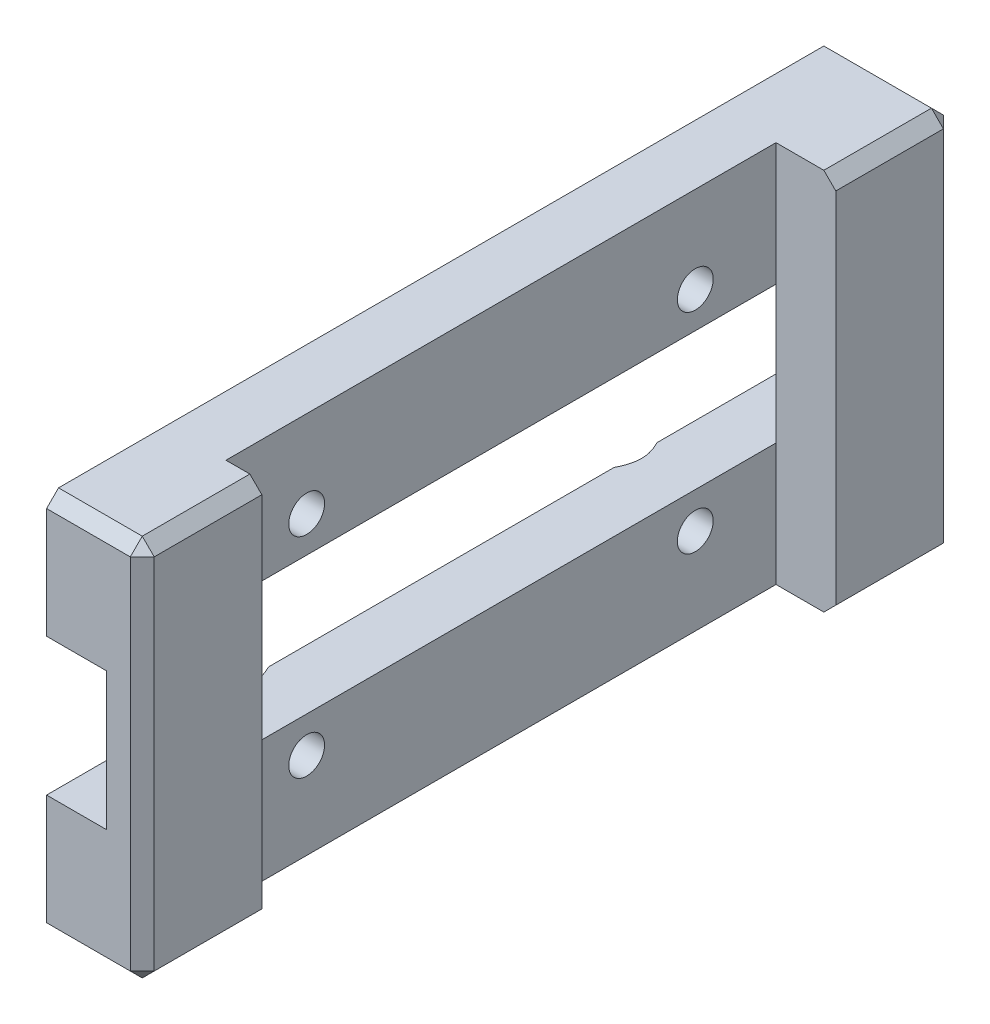
from build123d import *

# Parameters (mm, degrees)
SKETCH_2_W          = 66
SKETCH_2_H          = 32
EXTRUDE_1_DEPTH     = 5
SKETCH_3_W          = 46
SKETCH_3_H          = 11.5
CUT_EXTRUDE_2_DEPTH = 38.013511047
SKETCH_4_W          = 5
SKETCH_4_H          = 11.5
CUT_EXTRUDE_3_DEPTH = 69.095521145
SKETCH_5_W          = 10
SKETCH_5_H          = 32
EXTRUDE_2_DEPTH     = 5
SKETCH_6_W          = 10
SKETCH_6_H          = 32
EXTRUDE_3_DEPTH     = 3
SKETCH_7_R          = 1.5
CUT_EXTRUDE_4_DEPTH = 39.013155617
CHAMFER_1_SIZE      = 2
CHAMFER_2_SIZE      = 1


with BuildPart() as part:
    # 草图2 → 凸台-拉伸1 (new body)
    with BuildSketch(Plane(origin=(0, 0, 0), x_dir=(0, 0, -1), z_dir=(1, 0, 0))):
        Rectangle(SKETCH_2_W, SKETCH_2_H)
    extrude(amount=EXTRUDE_1_DEPTH)

    # 草图3 → 切除-拉伸2 (cut, through all)
    with BuildSketch(Plane.ZY):
        Rectangle(SKETCH_3_W, SKETCH_3_H)
    extrude(amount=-CUT_EXTRUDE_2_DEPTH, mode=Mode.SUBTRACT)

    # 草图4 → 切除-拉伸3 (cut, through all)
    with BuildSketch(Plane(origin=(0, 0, -33), x_dir=(-1, 0, 0), z_dir=(0, 0, -1))):
        with Locations((-2.5, 0)):
            Rectangle(SKETCH_4_W, SKETCH_4_H)
    extrude(amount=-CUT_EXTRUDE_3_DEPTH, mode=Mode.SUBTRACT)


with BuildPart() as cut_extrude_3_piece_1:
    # of the separate pieces the step leaves, piece 1, a body of its own (cut_extrude_3_pieces)
    add(part.part.solids().sort_by_distance((0, -16, -33))[0])



with BuildPart() as cut_extrude_3_piece_2:
    # of the separate pieces the step leaves, piece 2, a body of its own (cut_extrude_3_pieces)
    add(part.part.solids().sort_by_distance((0, 16, -33))[0])


with BuildPart() as cut_extrude_3_piece_1_1:
    add(cut_extrude_3_piece_1.part)

    add(cut_extrude_3_piece_2.part)  # 凸台-拉伸2 merges 切除-拉伸3 piece 2
    # 草图5 → 凸台-拉伸2 (add)
    with BuildSketch(Plane(origin=(5, 0, 0), x_dir=(0, 0, -1), z_dir=(1, 0, 0))):
        with Locations((28, 0)):
            Rectangle(SKETCH_5_W, SKETCH_5_H)
    extrude(amount=EXTRUDE_2_DEPTH)

    # 草图6 → 凸台-拉伸3 (add)
    with BuildSketch(Plane(origin=(5, 0, 0), x_dir=(0, 0, -1), z_dir=(1, 0, 0))):
        with Locations((-28, 0)):
            Rectangle(SKETCH_6_W, SKETCH_6_H)
    extrude(amount=EXTRUDE_3_DEPTH)

    # 草图7 → 切除-拉伸4 (cut, through all)
    with BuildSketch(Plane.ZY):
        with Locations((-16.25, 8.75)):
            Circle(SKETCH_7_R)
        with Locations((16.25, 8.75)):
            Circle(SKETCH_7_R)
        with Locations((16.25, -8.75)):
            Circle(SKETCH_7_R)
        with Locations((-16.25, -8.75)):
            Circle(SKETCH_7_R)
    extrude(amount=-CUT_EXTRUDE_4_DEPTH, mode=Mode.SUBTRACT)

    # 倒角1
    # the kernel refuses this chamfer: 2 mm, written as the material it takes off along each edge
    with BuildSketch(Plane(origin=(0, -8.75, -16.25), x_dir=(0, 0, 1), z_dir=(0, -1, 0))) as chamfer_1_piece_1:
        Polygon((1.5 + CHAMFER_1_SIZE, 0), (1.5, -CHAMFER_1_SIZE), (1.5, 0), align=None)
    revolve(axis=Axis((0, -8.75, -16.25), (-1, 0, 0)), mode=Mode.SUBTRACT)
    with BuildSketch(Plane(origin=(0, -8.75, 16.25), x_dir=(0, 0, 1), z_dir=(0, -1, 0))) as chamfer_1_piece_2:
        Polygon((1.5 + CHAMFER_1_SIZE, 0), (1.5, -CHAMFER_1_SIZE), (1.5, 0), align=None)
    revolve(axis=Axis((0, -8.75, 16.25), (-1, 0, 0)), mode=Mode.SUBTRACT)
    with BuildSketch(Plane(origin=(0, 8.75, 16.25), x_dir=(0, 0, 1), z_dir=(0, -1, 0))) as chamfer_1_piece_3:
        Polygon((1.5 + CHAMFER_1_SIZE, 0), (1.5, -CHAMFER_1_SIZE), (1.5, 0), align=None)
    revolve(axis=Axis((0, 8.75, 16.25), (-1, 0, 0)), mode=Mode.SUBTRACT)
    with BuildSketch(Plane(origin=(0, 8.75, -16.25), x_dir=(0, 0, 1), z_dir=(0, -1, 0))) as chamfer_1_piece_4:
        Polygon((1.5 + CHAMFER_1_SIZE, 0), (1.5, -CHAMFER_1_SIZE), (1.5, 0), align=None)
    revolve(axis=Axis((0, 8.75, -16.25), (-1, 0, 0)), mode=Mode.SUBTRACT)

    # 倒角2
    chamfer_2_edges = [cut_extrude_3_piece_1_1.edges().sort_by_distance(p)[0] for p in [
        (5, 16, -33),
        (10, -16, -28),
        (10, 0, -33),
        (10, 16, -28),
        (4, 16, 33),
        (5, -16, -33),
        (4, -16, 33),
        (8, 0, 33),
        (8, -16, 28),
        (8, 16, 28),
    ]]
    chamfer(chamfer_2_edges, length=CHAMFER_2_SIZE)


solid = cut_extrude_3_piece_1_1.part
